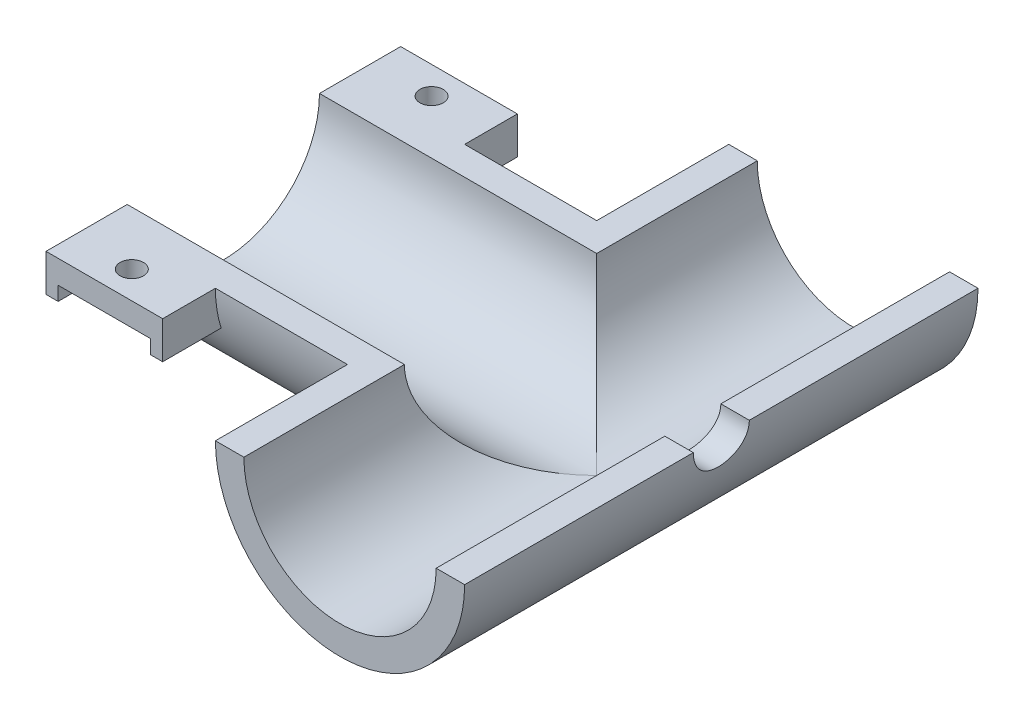
from build123d import *

# Parameters (mm, degrees)
SKETCH1_R                = 16.9545
BOSS_EXTRUDE1_DEPTH      = 50.8
SKETCH2_R                = 16.9545
BOSS_EXTRUDE2_DEPTH      = 34.925
SKETCH3_R                = 13.081
CUT_EXTRUDE1_DEPTH       = 50.8
SKETCH5_R                = 13.081
CUT_EXTRUDE2_DEPTH       = 69.85
CUT_EXTRUDE4_DEPTH       = 79.088942658
CUT_EXTRUDE4_DEPTH_BACK  = 79.088942658
SKETCH6_R                = 3.81
BOSS_EXTRUDE3_REACH      = 93.464
BOSS_EXTRUDE3_END_RADIUS = 16.9545
SKETCH8_W                = 15.875
SKETCH8_H                = 5.08
CUT_EXTRUDE5_REACH       = 93.464
CUT_EXTRUDE5_END_RADIUS  = 16.9545
SKETCH9_W                = 12.573
SKETCH9_H                = 1.905
SKETCH10_R               = 1.5875
CUT_EXTRUDE6_DEPTH       = 78.461619779


with BuildPart() as part:
    # Sketch1 → Boss-Extrude1 (new body)
    with BuildSketch(Plane(origin=(0, 0, 0), x_dir=(0, 0, -1), z_dir=(1, 0, 0))):
        Circle(SKETCH1_R)
    extrude(amount=BOSS_EXTRUDE1_DEPTH)

    # Sketch2 → Boss-Extrude2 (add, symmetric)
    with BuildSketch(Plane.XY):
        with Locations((50.8, 0)):
            Circle(SKETCH2_R)
    extrude(amount=BOSS_EXTRUDE2_DEPTH, both=True)

    # Sketch3 → Cut-Extrude1 (cut)
    with BuildSketch(Plane.ZY):
        Circle(SKETCH3_R)
    extrude(amount=-CUT_EXTRUDE1_DEPTH, mode=Mode.SUBTRACT)

    # Sketch5 → Cut-Extrude2 (cut)
    with BuildSketch(Plane(origin=(0, 0, -34.925), x_dir=(-1, 0, 0), z_dir=(0, 0, -1))):
        with Locations((-50.8, 0)):
            Circle(SKETCH5_R)
    extrude(amount=-CUT_EXTRUDE2_DEPTH, mode=Mode.SUBTRACT)

    # Sketch6 → Cut-Extrude4 (cut, two sides: drawn at the far end of the back side and taken through both)
    with BuildSketch(Plane(origin=(0, 0, 0), x_dir=(0, 0, -1), z_dir=(1, 0, 0)).offset(-CUT_EXTRUDE4_DEPTH_BACK)):
        with Locations(Location((0, 0, 0), (0, 0, 180))):
            Circle(SKETCH6_R)
    extrude(amount=CUT_EXTRUDE4_DEPTH + CUT_EXTRUDE4_DEPTH_BACK, mode=Mode.SUBTRACT)

    # SurfaceCut1
    split(bisect_by=Plane(origin=(0, 0, 0), x_dir=(1, 0, 0), z_dir=(0, 1, 0)), keep=Keep.BOTTOM)


with BuildPart() as body_2:
    # Boss-Extrude3: up to this cylinder (the profile starts outside it)
    boss_extrude3_end = Plane(origin=(7.9375, 0, 0), z_dir=(-1, 0, 0)) * Cylinder(BOSS_EXTRUDE3_END_RADIUS, 221.837, mode=Mode.PRIVATE)
    # Sketch8 → Boss-Extrude3 (new, up to the surface)
    with BuildSketch(Plane.XY.offset(24.13), mode=Mode.PRIVATE) as boss_extrude3_sk1:
        with Locations((7.9375, -2.54)):
            Rectangle(SKETCH8_W, SKETCH8_H)
    boss_extrude3_tool1 = extrude(boss_extrude3_sk1.sketch, amount=-BOSS_EXTRUDE3_REACH, mode=Mode.PRIVATE) - boss_extrude3_end
    add(boss_extrude3_tool1.solids().sort_by_distance((7.9375, -2.54, 24.13))[0])

    # Cut-Extrude5: up to this cylinder (the profile starts outside it)
    cut_extrude5_end = Plane(origin=(7.9375, 0, 0), z_dir=(-1, 0, 0)) * Cylinder(CUT_EXTRUDE5_END_RADIUS, 221.837, mode=Mode.PRIVATE)
    # Sketch9 → Cut-Extrude5 (cut, up to the surface)
    with BuildSketch(Plane.XY.offset(24.13), mode=Mode.PRIVATE) as cut_extrude5_sk1:
        with Locations((7.9375, -4.1275)):
            Rectangle(SKETCH9_W, SKETCH9_H)
    cut_extrude5_tool1 = extrude(cut_extrude5_sk1.sketch, amount=-CUT_EXTRUDE5_REACH, mode=Mode.PRIVATE) - cut_extrude5_end
    add(cut_extrude5_tool1.solids().sort_by_distance((7.9375, -4.1275, 24.13))[0], mode=Mode.SUBTRACT)


with BuildPart() as body_3:
    # Mirror1: mirrored copy
    add(body_2.part.mirror(Plane.XY))


with BuildPart() as part_1:
    add(part.part)

    # Intersect1: read off the stored shape, not the designer's step
    # Intersect1: union body 3, body 2
    add(body_3.part)
    add(body_2.part)

    # Sketch10 → Cut-Extrude6 (cut, through all)
    with BuildSketch(Plane.XZ.offset(3.175)):
        with Locations(Location((7.9375, 20.392281148, 0), (0, 0, 270))):
            Circle(SKETCH10_R)
    cut_extrude6 = extrude(amount=-CUT_EXTRUDE6_DEPTH, mode=Mode.SUBTRACT)

    # Mirror2: Cut-Extrude6 across plane
    add(cut_extrude6.mirror(Plane.XY), mode=Mode.SUBTRACT)


solid = part_1.part
